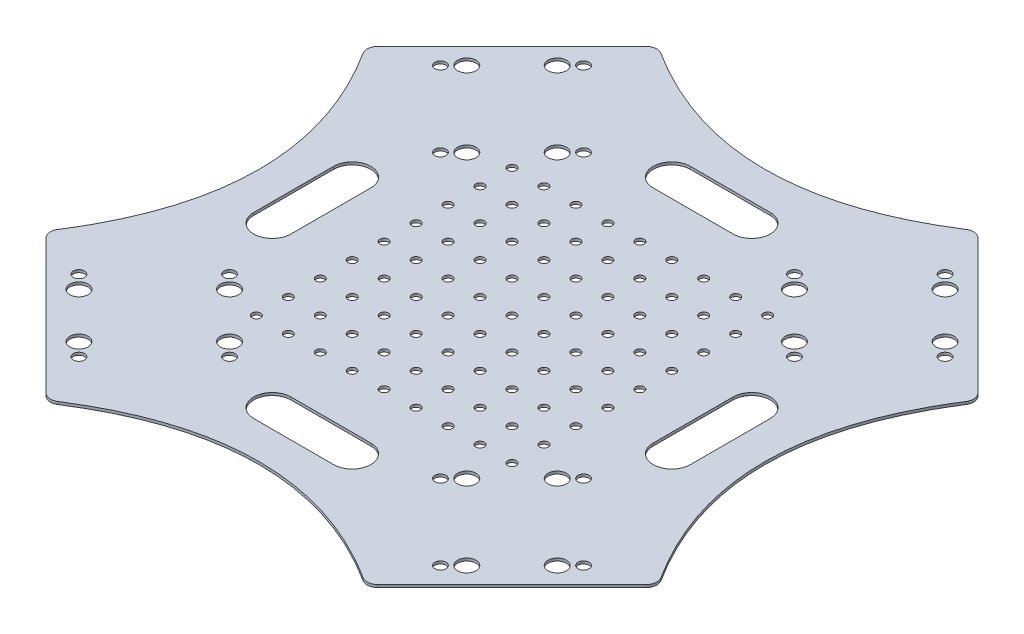
from build123d import *

# Parameters (mm, degrees)
DODANIE_WYCI_GNI_CIE1_DEPTH = 1
ZAOKR_GLENIE1_R             = 4
SZKIC2_R                    = 2.1
SZKIC2_R_2                  = 3.45
WYTNIJ_WYCI_GNI_CIE1_DEPTH  = 162.050129512
SZYK_KO_OWY1_COUNT          = 4
WYTNIJ_WYCI_GNI_CIE2_REACH  = 163.05
SZYK_KO_OWY2_COUNT          = 4
WYTNIJ_WYCI_GNI_CIE3_REACH  = 163.05
SZKIC4_R                    = 1.6
SZYK_LINIOWY1_COUNT         = 5
SZYK_LINIOWY1_PITCH         = 12
SZYK_LINIOWY1_COUNT_DIR2    = 5
SZYK_LINIOWY1_PITCH_DIR2    = 12
SZYK_KO_OWY3_OUTLINE_R      = 1.6
SZYK_KO_OWY3_DEPTH          = 1


# Read off the part's stored shape, not the designer's step: Szyk kołowy3
with BuildPart() as part:
    # Szkic1 → Dodanie-wyciągnięcie1 (new body)
    with BuildSketch(Plane(origin=(0, 0, 0), x_dir=(1, 0, 0), z_dir=(0, 1, 0))):
        with BuildLine():
            Line((-60, -115), (-115, -60))
            add(Edge.make_bspline(
                [(-115, 60), (-75, 0), (-115, -60)],
                knots=[0, 0, 0, 1, 1, 1], degree=2))
            Line((-115, 60), (-60, 115))
            add(Edge.make_bspline(
                [(60, 115), (0, 75), (-60, 115)],
                knots=[0, 0, 0, 1, 1, 1], degree=2))
            Line((60, 115), (115, 60))
            add(Edge.make_bspline(
                [(115, -60), (75, 0), (115, 60)],
                knots=[0, 0, 0, 1, 1, 1], degree=2))
            Line((115, -60), (60, -115))
            add(Edge.make_bspline(
                [(-60, -115), (0, -75), (60, -115)],
                knots=[0, 0, 0, 1, 1, 1], degree=2))
        make_face()
    extrude(amount=DODANIE_WYCI_GNI_CIE1_DEPTH)

    # Zaokrąglenie1
    zaokr_glenie1_edges = [part.edges().sort_by_distance(p)[0] for p in [
        (-115, 0.5, -60),
        (-60, 0.5, -115),
        (60, 0.5, -115),
        (115, 0.5, -60),
        (115, 0.5, 60),
        (60, 0.5, 115),
        (-115, 0.5, 60),
        (-60, 0.5, 115),
    ]]
    fillet(zaokr_glenie1_edges, radius=ZAOKR_GLENIE1_R)

    # Szkic2 → Wytnij-wyciągnięcie1 (cut, through all)
    with BuildSketch(Plane(origin=(0, 1, 0), x_dir=(1, 0, 0), z_dir=(0, 1, 0))):
        with Locations(Location((-67.882250994, -94.752308679, 0), (0, 0, 270))):
            Circle(SZKIC2_R)
        with Locations(Location((-94.752308679, -67.882250994, 0), (0, 0, 90))):
            Circle(SZKIC2_R)
        with Locations(Location((-39.597979746, -66.468037432, 0), (0, 0, 90))):
            Circle(SZKIC2_R)
        with Locations(Location((-66.468037432, -39.597979746, 0), (0, 0, 270))):
            Circle(SZKIC2_R)
        with Locations(Location((-72.831998462, -89.802561211, 0), (0, 0, 270))):
            Circle(SZKIC2_R_2)
        with Locations(Location((-89.802561211, -72.831998462, 0), (0, 0, 90))):
            Circle(SZKIC2_R_2)
        with Locations(Location((-61.518289963, -44.547727215, 0), (0, 0, 270))):
            Circle(SZKIC2_R_2)
        with Locations(Location((-44.547727215, -61.518289963, 0), (0, 0, 90))):
            Circle(SZKIC2_R_2)
    wytnij_wyci_gni_cie1 = extrude(amount=-WYTNIJ_WYCI_GNI_CIE1_DEPTH, mode=Mode.SUBTRACT)

    # Szyk kołowy1: Wytnij-wyciągnięcie1 ×4 about axis
    szyk_ko_owy1_axis = Axis((0, 0, 0), (0, 1, 0))
    for i in range(1, SZYK_KO_OWY1_COUNT):
        add(wytnij_wyci_gni_cie1.rotate(szyk_ko_owy1_axis, i * 360 / SZYK_KO_OWY1_COUNT), mode=Mode.SUBTRACT)

    # Szkic3 → Wytnij-wyciągnięcie2 (cut, up to next)
    with BuildSketch(Plane(origin=(0, 1, 0), x_dir=(1, 0, 0), z_dir=(0, 1, 0)), mode=Mode.PRIVATE) as wytnij_wyci_gni_cie2_sk1:
        with BuildLine():
            Line((-15, 82), (15, 82))
            ThreePointArc((15, 82), (22, 75), (15, 68))
            Line((15, 68), (-15, 68))
            ThreePointArc((-15, 68), (-22, 75), (-15, 82))
        make_face()
    wytnij_wyci_gni_cie2_tool1 = extrude(wytnij_wyci_gni_cie2_sk1.sketch, amount=-WYTNIJ_WYCI_GNI_CIE2_REACH, mode=Mode.PRIVATE) & part.part
    wytnij_wyci_gni_cie2 = wytnij_wyci_gni_cie2_tool1.solids().sort_by_distance((0, 1, -75))[0]
    add(wytnij_wyci_gni_cie2, mode=Mode.SUBTRACT)

    # Szyk kołowy2: Wytnij-wyciągnięcie2 ×4 about axis
    szyk_ko_owy2_axis = Axis((0, 0, 0), (0, 1, 0))
    for i in range(1, SZYK_KO_OWY2_COUNT):
        add(wytnij_wyci_gni_cie2.rotate(szyk_ko_owy2_axis, i * 360 / SZYK_KO_OWY2_COUNT), mode=Mode.SUBTRACT)

    # Szkic4 → Wytnij-wyciągnięcie3 (cut, up to next)
    with BuildSketch(Plane(origin=(0, 1, 0), x_dir=(1, 0, 0), z_dir=(0, 1, 0)), mode=Mode.PRIVATE) as wytnij_wyci_gni_cie3_sk1:
        with Locations(Location((0, 0, 0), (0, 0, 270))):
            Circle(SZKIC4_R)
    wytnij_wyci_gni_cie3_tool1 = extrude(wytnij_wyci_gni_cie3_sk1.sketch, amount=-WYTNIJ_WYCI_GNI_CIE3_REACH, mode=Mode.PRIVATE) & part.part
    wytnij_wyci_gni_cie3 = wytnij_wyci_gni_cie3_tool1.solids().sort_by_distance((0, 1, 0))[0]
    add(wytnij_wyci_gni_cie3, mode=Mode.SUBTRACT)

    # Szyk liniowy1: Wytnij-wyci_gni_cie3 5 × 5
    with Locations(*[(i * SZYK_LINIOWY1_PITCH, 0, j * SZYK_LINIOWY1_PITCH_DIR2) for i in range(SZYK_LINIOWY1_COUNT) for j in range(SZYK_LINIOWY1_COUNT_DIR2) if (i, j) != (0, 0)]):
        add(wytnij_wyci_gni_cie3, mode=Mode.SUBTRACT)

    # Szyk kołowy3 outline → Szyk kołowy3 (cut)
    with BuildSketch(Plane(origin=(0, 0, 0), x_dir=(1, 0, 0), z_dir=(0, 1, 0))):
        with Locations((0, 48)):
            Circle(SZYK_KO_OWY3_OUTLINE_R)
        with Locations((48, 36)):
            Circle(SZYK_KO_OWY3_OUTLINE_R)
        with Locations((36, 36)):
            Circle(SZYK_KO_OWY3_OUTLINE_R)
        with Locations((24, 36)):
            Circle(SZYK_KO_OWY3_OUTLINE_R)
        with Locations((12, 48)):
            Circle(SZYK_KO_OWY3_OUTLINE_R)
        with Locations((24, 48)):
            Circle(SZYK_KO_OWY3_OUTLINE_R)
        with Locations((36, 48)):
            Circle(SZYK_KO_OWY3_OUTLINE_R)
        with Locations((48, 48)):
            Circle(SZYK_KO_OWY3_OUTLINE_R)
        with Locations((0, 12)):
            Circle(SZYK_KO_OWY3_OUTLINE_R)
        with Locations((12, 12)):
            Circle(SZYK_KO_OWY3_OUTLINE_R)
        with Locations((24, 12)):
            Circle(SZYK_KO_OWY3_OUTLINE_R)
        with Locations((36, 12)):
            Circle(SZYK_KO_OWY3_OUTLINE_R)
        with Locations((12, 36)):
            Circle(SZYK_KO_OWY3_OUTLINE_R)
        with Locations((0, 36)):
            Circle(SZYK_KO_OWY3_OUTLINE_R)
        with Locations((48, 24)):
            Circle(SZYK_KO_OWY3_OUTLINE_R)
        with Locations((36, 24)):
            Circle(SZYK_KO_OWY3_OUTLINE_R)
        with Locations((48, 12)):
            Circle(SZYK_KO_OWY3_OUTLINE_R)
        with Locations((0, 24)):
            Circle(SZYK_KO_OWY3_OUTLINE_R)
        with Locations((12, 24)):
            Circle(SZYK_KO_OWY3_OUTLINE_R)
        with Locations((24, 24)):
            Circle(SZYK_KO_OWY3_OUTLINE_R)
        with Locations((-48, 0)):
            Circle(SZYK_KO_OWY3_OUTLINE_R)
        with Locations((-36, 48)):
            Circle(SZYK_KO_OWY3_OUTLINE_R)
        with Locations((-36, 36)):
            Circle(SZYK_KO_OWY3_OUTLINE_R)
        with Locations((-36, 24)):
            Circle(SZYK_KO_OWY3_OUTLINE_R)
        with Locations((-48, 12)):
            Circle(SZYK_KO_OWY3_OUTLINE_R)
        with Locations((-48, 24)):
            Circle(SZYK_KO_OWY3_OUTLINE_R)
        with Locations((-48, 36)):
            Circle(SZYK_KO_OWY3_OUTLINE_R)
        with Locations((-48, 48)):
            Circle(SZYK_KO_OWY3_OUTLINE_R)
        with Locations((-12, 0)):
            Circle(SZYK_KO_OWY3_OUTLINE_R)
        with Locations((-12, 12)):
            Circle(SZYK_KO_OWY3_OUTLINE_R)
        with Locations((-12, 24)):
            Circle(SZYK_KO_OWY3_OUTLINE_R)
        with Locations((-12, 36)):
            Circle(SZYK_KO_OWY3_OUTLINE_R)
        with Locations((-36, 12)):
            Circle(SZYK_KO_OWY3_OUTLINE_R)
        with Locations((-36, 0)):
            Circle(SZYK_KO_OWY3_OUTLINE_R)
        with Locations((-24, 48)):
            Circle(SZYK_KO_OWY3_OUTLINE_R)
        with Locations((-24, 36)):
            Circle(SZYK_KO_OWY3_OUTLINE_R)
        with Locations((-12, 48)):
            Circle(SZYK_KO_OWY3_OUTLINE_R)
        with Locations((-24, 0)):
            Circle(SZYK_KO_OWY3_OUTLINE_R)
        with Locations((-24, 12)):
            Circle(SZYK_KO_OWY3_OUTLINE_R)
        with Locations((-24, 24)):
            Circle(SZYK_KO_OWY3_OUTLINE_R)
        with Locations((-48, -36)):
            Circle(SZYK_KO_OWY3_OUTLINE_R)
        with Locations((-36, -36)):
            Circle(SZYK_KO_OWY3_OUTLINE_R)
        with Locations((-24, -36)):
            Circle(SZYK_KO_OWY3_OUTLINE_R)
        with Locations((-12, -48)):
            Circle(SZYK_KO_OWY3_OUTLINE_R)
        with Locations((-24, -48)):
            Circle(SZYK_KO_OWY3_OUTLINE_R)
        with Locations((-36, -48)):
            Circle(SZYK_KO_OWY3_OUTLINE_R)
        with Locations((-48, -48)):
            Circle(SZYK_KO_OWY3_OUTLINE_R)
        with Locations((-12, -12)):
            Circle(SZYK_KO_OWY3_OUTLINE_R)
        with Locations((-24, -12)):
            Circle(SZYK_KO_OWY3_OUTLINE_R)
        with Locations((-36, -12)):
            Circle(SZYK_KO_OWY3_OUTLINE_R)
        with Locations((-12, -36)):
            Circle(SZYK_KO_OWY3_OUTLINE_R)
        with Locations((-48, -24)):
            Circle(SZYK_KO_OWY3_OUTLINE_R)
        with Locations((-36, -24)):
            Circle(SZYK_KO_OWY3_OUTLINE_R)
        with Locations((-48, -12)):
            Circle(SZYK_KO_OWY3_OUTLINE_R)
        with Locations((-12, -24)):
            Circle(SZYK_KO_OWY3_OUTLINE_R)
        with Locations((-24, -24)):
            Circle(SZYK_KO_OWY3_OUTLINE_R)
    extrude(amount=SZYK_KO_OWY3_DEPTH, mode=Mode.SUBTRACT)


solid = part.part
